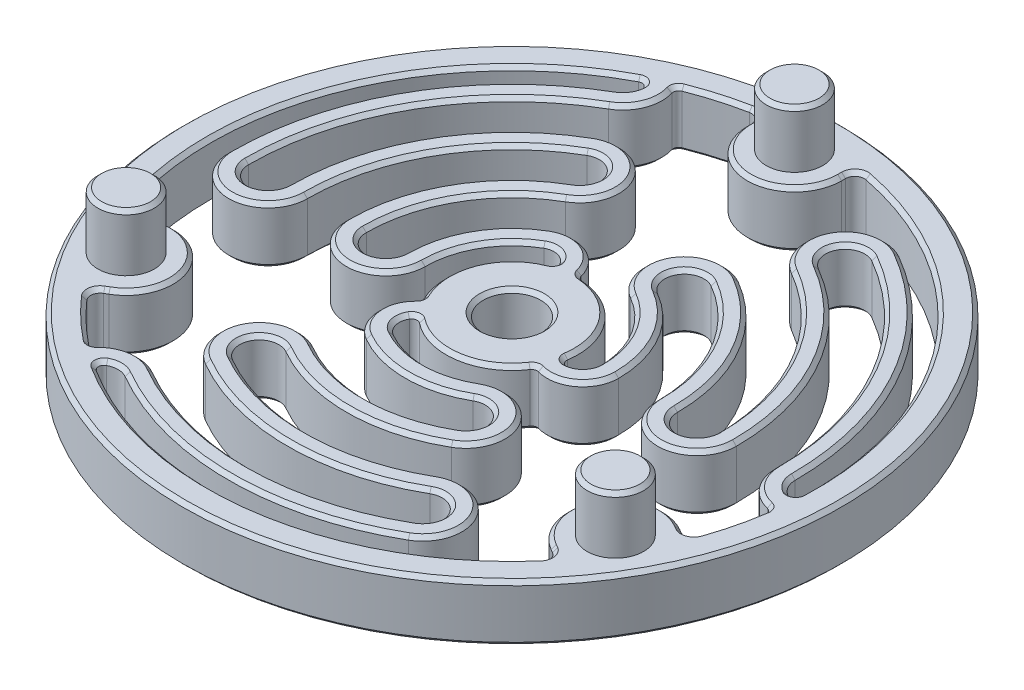
from build123d import *

# Parameters (mm, degrees)
SKETCH1_R                    = 35
SKETCH1_R_2                  = 32
BOSS_EXTRUDE1_DEPTH          = 6
BOSS_EXTRUDE3_START          = -6
BOSS_EXTRUDE3_DEPTH          = 6
SKETCH4_R                    = 3
BOSS_EXTRUDE4_DEPTH          = 6
CHAMFER1_SIZE                = 0.4
FILLET1_R                    = 1
EXTRUDE_THIN1_DEPTH          = 6
SKETCH6_R                    = 7
SKETCH6_R_2                  = 3.05
BOSS_EXTRUDE5_DEPTH          = 6
FILLET2_R                    = 0.6
CIRPATTERN1_COUNT            = 3
CHAMFER1_OF_CIRPATTERN1_SIZE = 0.4
FILLET1_OF_CIRPATTERN1_R     = 1
FILLET2_OF_CIRPATTERN1_R     = 0.6
CHAMFER2_SIZE                = 0.4


# Read off the part's stored shape, not the designer's step: DeleteFace1
with BuildPart() as part:
    # Sketch1 → Boss-Extrude1 (new body)
    with BuildSketch(Plane(origin=(0, 0, 0), x_dir=(1, 0, 0), z_dir=(0, 1, 0))):
        with Locations(Location((0, 0, 0), (0, 0, 270))):
            Circle(SKETCH1_R)
        with Locations(Location((0, 0, 0), (0, 0, 270))):
            Circle(SKETCH1_R_2, mode=Mode.SUBTRACT)
    extrude(amount=BOSS_EXTRUDE1_DEPTH)

    # Sketch3 → Boss-Extrude3 (add)
    with BuildSketch(Plane(origin=(0, 6, 0), x_dir=(1, 0, 0), z_dir=(0, 1, 0)).offset(BOSS_EXTRUDE3_START)):
        with BuildLine():
            Line((-5, 30), (-5, 31.606961259))
            ThreePointArc((-5, 31.606961259), (0, 32), (5, 31.606961259))
            Line((5, 31.606961259), (5, 30))
            ThreePointArc((5, 30), (0, 25), (-5, 30))
        make_face()
    boss_extrude3 = extrude(amount=BOSS_EXTRUDE3_DEPTH)

    # Sketch4 → Boss-Extrude4 (add)
    with BuildSketch(Plane(origin=(0, 6, 0), x_dir=(1, 0, 0), z_dir=(0, 1, 0))):
        with Locations(Location((0, 30, 0), (0, 0, 270))):
            Circle(SKETCH4_R)
    boss_extrude4 = extrude(amount=BOSS_EXTRUDE4_DEPTH)

    # Chamfer1
    chamfer1_edges = [part.edges().sort_by_distance(p)[0] for p in [
        (0, 12, -33),
    ]]
    chamfer(chamfer1_edges, length=CHAMFER1_SIZE)

    # Fillet1
    fillet1_edges = [part.edges().sort_by_distance(p)[0] for p in [
        (-5, 3, -31.606961259),
        (5, 3, -31.606961259),
    ]]
    fillet(fillet1_edges, radius=FILLET1_R)

    # Sketch5 → Extrude-Thin1 (add)
    with BuildSketch(Plane(origin=(0, 6, 0), x_dir=(1, 0, 0), z_dir=(0, 1, 0))):
        with BuildLine():
            Line((0.149597592, 6.089344838), (0.001461306, 7.078311795))
            ThreePointArc((0.001461306, 7.078311795), (-2.108894349, 9.941858199), (-5.663612909, 9.809665312))
            ThreePointArc((-5.663612909, 9.809665312), (-9.809665312, 5.663612909), (-11.327225817, 0))
            ThreePointArc((-11.327225817, 0), (-13.402225817, -2.075), (-15.477225817, 0))
            ThreePointArc((-15.477225817, 0), (-13.403670738, 7.738612909), (-7.738612909, 13.403670738))
            ThreePointArc((-7.738612909, 13.403670738), (-6.210456848, 19.106826799), (-11.913612909, 20.634982859))
            ThreePointArc((-11.913612909, 20.634982859), (-20.634982859, 11.913612909), (-23.827225817, 0))
            ThreePointArc((-23.827225817, 0), (-25.902225817, -2.075), (-27.977225817, 0))
            ThreePointArc((-27.977225817, 0), (-24.228988285, 13.988612909), (-13.988612909, 24.228988285))
            ThreePointArc((-13.988612909, 24.228988285), (-12.100723344, 26.569143343), (-12.274683044, 29.570841317))
            Line((-12.274683044, 29.570841317), (-12.688143396, 30.48136344))
            Line((-12.688143396, 30.48136344), (-14.600239855, 29.6130967))
            Line((-14.600239855, 29.6130967), (-14.186779503, 28.702574577))
            ThreePointArc((-14.186779503, 28.702574577), (-14.10032049, 27.21071271), (-15.038612909, 26.047641633))
            ThreePointArc((-15.038612909, 26.047641633), (-26.047641633, 15.038612909), (-30.077225817, 0))
            ThreePointArc((-30.077225817, 0), (-25.902225817, -4.175), (-21.727225817, 0))
            ThreePointArc((-21.727225817, 0), (-18.816329511, 10.863612909), (-10.863612909, 18.816329511))
            ThreePointArc((-10.863612909, 18.816329511), (-8.029110196, 18.056826799), (-8.788612909, 15.222324086))
            ThreePointArc((-8.788612909, 15.222324086), (-15.222324086, 8.788612909), (-17.577225817, 0))
            ThreePointArc((-17.577225817, 0), (-13.402225817, -4.175), (-9.227225817, 0))
            ThreePointArc((-9.227225817, 0), (-7.991011964, 4.613612909), (-4.613612909, 7.991011964))
            ThreePointArc((-4.613612909, 7.991011964), (-3.0209168, 8.050241153), (-2.075369302, 6.767225595))
            Line((-2.075369302, 6.767225595), (-1.927233017, 5.778258639))
            Line((-1.927233017, 5.778258639), (0.149597592, 6.089344838))
        make_face()
    extrude_thin1 = extrude(amount=-EXTRUDE_THIN1_DEPTH)

    # Sketch6 → Boss-Extrude5 (add)
    with BuildSketch(Plane(origin=(0, 6, 0), x_dir=(1, 0, 0), z_dir=(0, 1, 0))):
        Circle(SKETCH6_R)
        with Locations(Location((0, 0, 0), (0, 0, 270))):
            Circle(SKETCH6_R_2, mode=Mode.SUBTRACT)
    extrude(amount=-BOSS_EXTRUDE5_DEPTH)

    # Fillet2
    fillet2_edges = [part.edges().sort_by_distance(p)[0] for p in [
        (0.013193407, 3, -6.999987567),
        (-2.063637201, 3, -6.688901367),
        (-12.26759148, 3, -29.555138289),
        (-14.179719275, 3, -28.686853457),
    ]]
    fillet(fillet2_edges, radius=FILLET2_R)

    # CirPattern1: Boss-Extrude3, Boss-Extrude4, Extrude-Thin1 ×3 about axis
    cirpattern1_axis = Axis((0, 0, 0), (0, 1, 0))
    add([boss_extrude3.rotate(cirpattern1_axis, i * 360 / CIRPATTERN1_COUNT) for i in range(1, CIRPATTERN1_COUNT)])
    add([boss_extrude4.rotate(cirpattern1_axis, i * 360 / CIRPATTERN1_COUNT) for i in range(1, CIRPATTERN1_COUNT)])
    add([extrude_thin1.rotate(cirpattern1_axis, i * 360 / CIRPATTERN1_COUNT) for i in range(1, CIRPATTERN1_COUNT)])

    # Chamfer1 of CirPattern1
    chamfer1_of_cirpattern1_edges = [part.edges().sort_by_distance(p)[0] for p in [
        (-28.578838325, 12, 16.5),
        (28.578838325, 12, 16.5),
    ]]
    chamfer(chamfer1_of_cirpattern1_edges, length=CHAMFER1_OF_CIRPATTERN1_SIZE)

    # Fillet1 of CirPattern1
    fillet1_of_cirpattern1_edges = [part.edges().sort_by_distance(p)[0] for p in [
        (-24.872431386, 3, 20.133607648),
        (-29.872431386, 3, 11.47335361),
        (29.872431386, 3, 11.47335361),
        (24.872431386, 3, 20.133607648),
    ]]
    fillet(fillet1_of_cirpattern1_edges, radius=FILLET1_OF_CIRPATTERN1_R)

    # Fillet2 of CirPattern1
    fillet2_of_cirpattern1_edges = [part.edges().sort_by_distance(p)[0] for p in [
        (-6.068763763, 3, 3.488567957),
        (-4.760939907, 3, 5.131612924),
        (-19.46170483, 3, 25.40161501),
        (-17.753684211, 3, 26.623423839),
        (6.055570355, 3, 3.511419609),
        (6.824577108, 3, 1.557288443),
        (31.729296311, 3, 4.153523279),
        (31.933403486, 3, 2.063429618),
    ]]
    fillet(fillet2_of_cirpattern1_edges, radius=FILLET2_OF_CIRPATTERN1_R)

    # Chamfer2
    chamfer2_edges = [part.edges().sort_by_distance(p)[0] for p in [
        (0, 0, -3.05),
        (0, 6, -3.05),
        (0, 6, -25),
        (5, 6, -30.206906326),
        (-2.275648542, 0, -10.017368207),
        (-6.530221559, 6, -2.521151798),
        (5.448492283, 0, -4.394761864),
        (-3.317639189, 0, -8.160663581),
        (-12.195557888, 6, -26.30454119),
        (0, 0, -25),
        (-14.295628129, 6, -26.779046415),
        (-5, 0, -30.206906326),
        (-29.727285408, 6, -11.844344738),
        (-29.727285408, 0, -11.844344738),
        (0.126999955, 0, -7.122536468),
        (0.126999955, 6, -7.122536468),
        (-2.236538607, 0, -6.866297748),
        (-2.236538607, 6, -6.866297748),
        (-12.042378475, 0, -29.479374579),
        (-12.042378475, 6, -29.479374579),
        (-14.283498353, 0, -28.306898195),
        (-14.283498353, 6, -28.306898195),
        (-21.650635095, 6, 12.5),
        (-28.659948248, 6, 10.773326144),
        (-21.650635095, 0, 12.5),
        (-23.659948248, 0, 19.433580182),
        (21.650635095, 6, 12.5),
        (23.659948248, 6, 19.433580182),
        (21.650635095, 0, 12.5),
        (28.659948248, 0, 10.773326144),
        (-28.578838325, 6, 16.5),
        (28.578838325, 6, 16.5),
        (0, 0, -35),
        (-28.659948248, 0, 10.773326144),
        (-22.098305647, 6, 23.144435347),
        (-22.098305647, 0, 23.144435347),
        (-23.659948248, 6, 19.433580182),
        (-29.690648747, 6, 10.946936391),
        (-29.690648747, 0, 10.946936391),
        (-24.325649382, 6, 20.239387874),
        (-24.325649382, 0, 20.239387874),
        (23.659948248, 0, 19.433580182),
        (31.09282179, 6, 7.565476398),
        (31.09282179, 0, 7.565476398),
        (28.659948248, 6, 10.773326144),
        (24.325649382, 6, 20.239387874),
        (24.325649382, 0, 20.239387874),
        (29.690648747, 6, 10.946936391),
        (29.690648747, 0, 10.946936391),
        (0, 6, -33),
        (0, 6, 30.077225817),
        (16.566768969, 6, 20.344485572),
        (0, 6, 21.727225817),
        (-11.623115621, 6, 15.981826799),
        (0, 6, 17.577225817),
        (10.316768969, 6, 9.519168025),
        (0, 6, 9.227225817),
        (-5.408522379, 6, 6.953491609),
        (-7.537471076, 6, 6.979453551),
        (0, 0, 11.327225817),
        (0, 6, 11.327225817),
        (8.498115621, 0, 10.569168025),
        (8.498115621, 6, 10.569168025),
        (0, 0, 15.477225817),
        (0, 6, 15.477225817),
        (-13.441768969, 0, 14.931826799),
        (-13.441768969, 6, 14.931826799),
        (0, 0, 23.827225817),
        (0, 6, 23.827225817),
        (14.748115621, 0, 21.394485572),
        (14.748115621, 6, 21.394485572),
        (0, 0, 27.977225817),
        (0, 6, 27.977225817),
        (-16.682621961, 0, 23.713933539),
        (0, 0, 9.227225817),
        (10.316768969, 0, 9.519168025),
        (0, 0, 17.577225817),
        (-11.623115621, 0, 15.981826799),
        (0, 0, 21.727225817),
        (16.566768969, 0, 20.344485572),
        (0, 0, 30.077225817),
        (-16.04352042, 0, 25.76990033),
        (5, 0, -30.206906326),
        (26.047641633, 6, -15.038612909),
        (9.335456848, 6, -24.519485572),
        (18.816329511, 6, -10.863612909),
        (19.652225817, 6, 2.075),
        (15.222324086, 6, -8.788612909),
        (3.085456848, 6, -13.694168025),
        (7.991011964, 6, -4.613612909),
        (8.726161568, 6, 1.207171972),
        (9.813119618, 6, 3.037914656),
        (9.809665312, 0, -5.663612909),
        (9.809665312, 6, -5.663612909),
        (4.904110196, 0, -12.644168025),
        (4.904110196, 6, -12.644168025),
        (13.403670738, 0, -7.738612909),
        (13.403670738, 6, -7.738612909),
        (19.652225817, 0, 4.175),
        (-8.994516143, 6, -30.709911744),
        (19.652225817, 6, 4.175),
        (20.634982859, 0, -11.913612909),
        (20.634982859, 6, -11.913612909),
        (11.154110196, 0, -23.469485572),
        (11.154110196, 6, -23.469485572),
        (24.228988285, 0, -13.988612909),
        (24.228988285, 6, -13.988612909),
        (28.878179849, 0, 2.590607651),
        (7.991011964, 0, -4.613612909),
        (3.085456848, 0, -13.694168025),
        (15.222324086, 0, -8.788612909),
        (19.652225817, 0, 2.075),
        (18.816329511, 0, -10.863612909),
        (9.335456848, 0, -24.519485572),
        (26.047641633, 0, -15.038612909),
        (30.339148549, 0, 1.009146084),
        (-8.994516143, 0, -30.709911744),
        (-5, 6, -30.206906326),
        (5.364999365, 6, -31.186324265),
        (5.364999365, 0, -31.186324265),
        (-5.364999365, 6, -31.186324265),
        (-5.364999365, 0, -31.186324265),
        (-6.530221559, 0, -2.521151798),
        (-7.537471076, 0, 6.979453551),
        (-5.408522379, 0, 6.953491609),
        (1.081729276, 6, 6.915913662),
        (-16.682621961, 6, 23.713933539),
        (-16.04352042, 6, 25.76990033),
        (4.60613927, 6, 31.666756718),
        (4.60613927, 0, 31.666756718),
        (-6.231797499, 6, 3.451283047),
        (-6.231797499, 0, 3.451283047),
        (-4.828118976, 6, 5.370048124),
        (-4.828118976, 0, 5.370048124),
        (-19.508698036, 0, 25.168692971),
        (-19.508698036, 6, 25.168692971),
        (-17.372743763, 0, 26.523321527),
        (-17.372743763, 6, 26.523321527),
        (1.081729276, 0, 6.915913662),
        (9.813119618, 0, 3.037914656),
        (8.726161568, 0, 1.207171972),
        (5.448492283, 6, -4.394761864),
        (28.878179849, 6, 2.590607651),
        (30.339148549, 6, 1.009146084),
        (25.121146138, 6, -19.82241198),
        (25.121146138, 0, -19.82241198),
        (6.104797543, 6, 3.671253422),
        (6.104797543, 0, 3.671253422),
        (7.064657583, 6, 1.496249624),
        (7.064657583, 0, 1.496249624),
        (31.551076511, 0, 4.310681608),
        (31.551076511, 6, 4.310681608),
        (31.656242116, 0, 1.783576669),
        (31.656242116, 6, 1.783576669),
        (0, 6, -35),
        (-26.047641633, 6, -15.038612909),
        (-25.902225817, 6, 4.175),
        (-18.816329511, 6, -10.863612909),
        (-8.029110196, 6, -18.056826799),
        (-15.222324086, 6, -8.788612909),
        (-13.402225817, 6, 4.175),
        (-7.991011964, 6, -4.613612909),
        (-3.317639189, 6, -8.160663581),
        (-7.991011964, 0, -4.613612909),
        (-13.402225817, 0, 4.175),
        (-15.222324086, 0, -8.788612909),
        (-8.029110196, 0, -18.056826799),
        (-18.816329511, 0, -10.863612909),
        (-25.902225817, 0, 4.175),
        (-26.047641633, 0, -15.038612909),
        (-14.295628129, 0, -26.779046415),
        (-2.275648542, 6, -10.017368207),
        (-9.809665312, 0, -5.663612909),
        (-9.809665312, 6, -5.663612909),
        (-13.402225817, 0, 2.075),
        (-13.402225817, 6, 2.075),
        (-13.403670738, 0, -7.738612909),
        (-13.403670738, 6, -7.738612909),
        (-6.210456848, 0, -19.106826799),
        (-6.210456848, 6, -19.106826799),
        (-20.634982859, 0, -11.913612909),
        (-20.634982859, 6, -11.913612909),
        (-25.902225817, 0, 2.075),
        (-25.902225817, 6, 2.075),
        (-24.228988285, 0, -13.988612909),
        (-24.228988285, 6, -13.988612909),
        (-12.195557888, 0, -26.30454119),
    ]]
    chamfer(chamfer2_edges, length=CHAMFER2_SIZE)

    # DeleteFace1 outline → DeleteFace1 (revolve, cut)
    with BuildSketch(Plane.XY.offset(-30)):
        Polygon((3.4, 6), (3, 6.4), (3, 6), align=None)
    revolve(axis=Axis((0, 0, -30), (0, 1, 0)), mode=Mode.SUBTRACT)

    # DeleteFace1 2 outline → DeleteFace1 2 (revolve, cut)
    with BuildSketch(Plane(origin=(25.980762114, 0, 15), x_dir=(1, 0, 0), z_dir=(0, 0, 1))):
        Polygon((3.4, 6), (3, 6.4), (3, 6), align=None)
    revolve(axis=Axis((25.980762114, 0, 15), (0, 1, 0)), mode=Mode.SUBTRACT)

    # DeleteFace1 3 outline → DeleteFace1 3 (revolve, cut)
    with BuildSketch(Plane(origin=(-25.980762114, 0, 15), x_dir=(1, 0, 0), z_dir=(0, 0, 1))):
        Polygon((3.4, 6), (3, 6.4), (3, 6), align=None)
    revolve(axis=Axis((-25.980762114, 0, 15), (0, 1, 0)), mode=Mode.SUBTRACT)


solid = part.part
